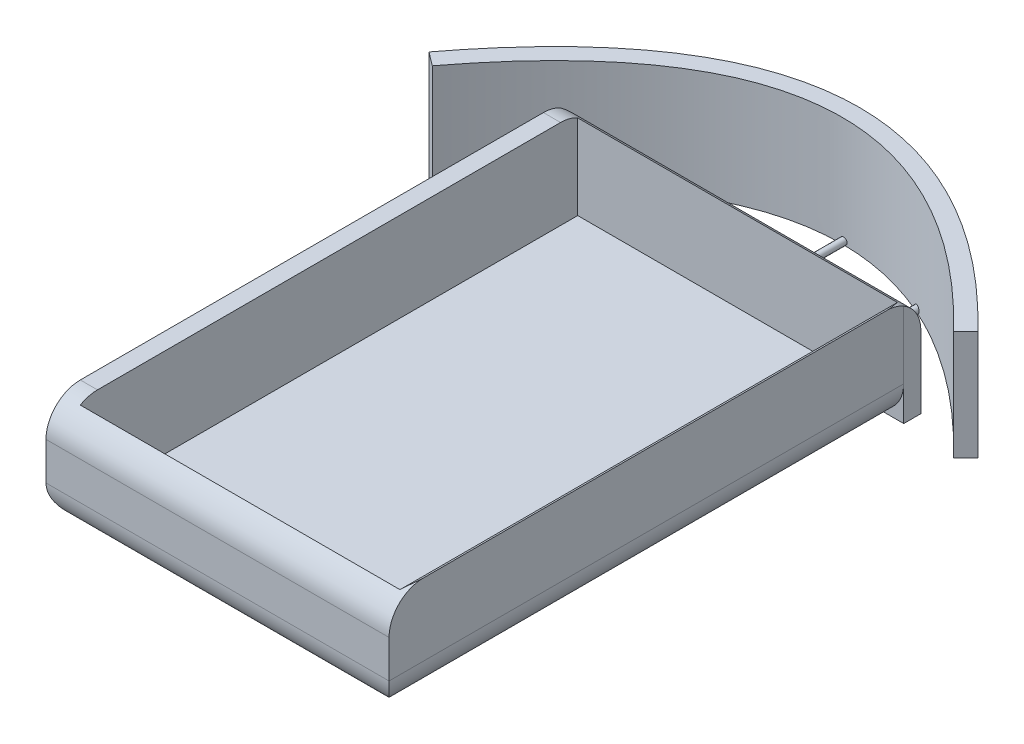
from build123d import *

# Parameters (mm, degrees)
BOSS_EXTRUDE1_DEPTH = 31
SKETCH5_W           = 90
SKETCH5_H           = 144.999999519
CUT_EXTRUDE2_DEPTH  = 26
SKETCH10_R          = 1.05
SKETCH10_R_2        = 1
BOSS_EXTRUDE3_DEPTH = 21
EXTRUDE_THIN2_START = -32
EXTRUDE_THIN2_DEPTH = 32
FILLET2_R           = 10
FILLET4_R           = 10
FILLET5_R           = 10
FILLET6_R           = 10
SKETCH15_R          = 1
BOSS_EXTRUDE4_DEPTH = 28


# Read off the part's stored shape, not the designer's step: Extrude-Thin2
with BuildPart() as part:
    # Sketch4 → Boss-Extrude1 (new body)
    with BuildSketch(Plane(origin=(0, 0, 0), x_dir=(1, 0, 0), z_dir=(0, 1, 0))):
        Polygon((-24.543123589, 51.393890829), (-24.485724986, 51.393890829), (-24.485724986, -98.606109173), (75.514275014, -98.606109173), (75.514275014, 51.393890827), (75.547211032, 51.393890827), (75.547211032, 56.393890829), (-24.543123589, 56.393890829), align=None)
    extrude(amount=BOSS_EXTRUDE1_DEPTH)

    # Sketch5 → Cut-Extrude2 (cut)
    with BuildSketch(Plane(origin=(0, 31, 0), x_dir=(1, 0, 0), z_dir=(0, 1, 0))):
        with Locations((25.514275014, -21.106109414)):
            Rectangle(SKETCH5_W, SKETCH5_H)
    extrude(amount=-CUT_EXTRUDE2_DEPTH, mode=Mode.SUBTRACT)

    # Sketch10 → Boss-Extrude3 (add)
    with BuildSketch(Plane(origin=(0, 0, -56.393890829), x_dir=(-1, 0, 0), z_dir=(0, 0, -1))):
        with Locations(Location((-55.547211032, 7, 0), (0, 0, 180))):
            Circle(SKETCH10_R)
        with Locations(Location((4.543123589, 7, 0), (0, 0, 180))):
            Circle(SKETCH10_R_2)
    extrude(amount=BOSS_EXTRUDE3_DEPTH)

    # Fillet2
    # the kernel refuses this fillet: 10 mm, written as the material it takes off along each edge
    with BuildSketch(Plane(origin=(-49.485724986, 31, 98.606109173), x_dir=(0, 0, -1), z_dir=(1, 0, 0))) as fillet2_piece_1:
        with BuildLine():
            CenterArc((FILLET2_R, -FILLET2_R), FILLET2_R, 90, 90)
            Line((0, -FILLET2_R), (0, 0))
            Line((0, 0), (FILLET2_R, 0))
        make_face()
    extrude(amount=150, mode=Mode.SUBTRACT)
    with BuildSketch(Plane(origin=(-24.485724986, 0, -51.393890829), x_dir=(0, 1, 0), z_dir=(0, 0, 1))) as fillet2_piece_2:
        with BuildLine():
            CenterArc((FILLET2_R, -FILLET2_R), FILLET2_R, 90, 90)
            Line((0, -FILLET2_R), (0, 0))
            Line((0, 0), (FILLET2_R, 0))
        make_face()
    extrude(amount=175.000000002, mode=Mode.SUBTRACT)
    with BuildSketch(Plane(origin=(-49.485724986, 0, 98.606109173), x_dir=(0, 0, -1), z_dir=(1, 0, 0))) as fillet2_piece_3:
        with BuildLine():
            CenterArc((FILLET2_R, FILLET2_R), FILLET2_R, 180, 90)
            Line((0, FILLET2_R), (0, 0))
            Line((0, 0), (FILLET2_R, 0))
        make_face()
    extrude(amount=150, mode=Mode.SUBTRACT)
    with BuildSketch(Plane(origin=(75.514275014, 0, 123.606109173), x_dir=(-1, 0, 0), z_dir=(0, 0, -1))) as fillet2_piece_4:
        with BuildLine():
            CenterArc((FILLET2_R, FILLET2_R), FILLET2_R, 180, 90)
            Line((0, FILLET2_R), (0, 0))
            Line((0, 0), (FILLET2_R, 0))
        make_face()
    extrude(amount=175, mode=Mode.SUBTRACT)

    # Fillet4
    # the kernel refuses this fillet: 10 mm, written as the material it takes off along each edge
    with BuildSketch(Plane(origin=(70.514275014, 31, -73.044525441), x_dir=(0, -1, 0), z_dir=(0, 0, 1))) as fillet4_piece_1_section:
        with BuildLine():
            CenterArc((8.660254038, 10), FILLET4_R, 210, 60)
            Line((0, 5), (0, 0))
            Line((0, 0), (8.660254038, 0))
        make_face()
    fillet4_piece_1 = extrude(amount=183.301269709, mode=Mode.PRIVATE)
    fillet4_piece_1 = split(fillet4_piece_1, bisect_by=Plane(origin=(71.836700468, 27.349745962, -51.393890827), z_dir=(0, 0, 1)), keep=Keep.TOP, mode=Mode.PRIVATE)
    fillet4_piece_1 = split(fillet4_piece_1, bisect_by=Plane(origin=(71.836700468, 27.349745962, 93.606109173), z_dir=(0, 0, -1)), keep=Keep.TOP, mode=Mode.PRIVATE)
    add(fillet4_piece_1, mode=Mode.SUBTRACT)

    # Fillet5
    # the kernel refuses this fillet: 10 mm, written as the material it takes off along each edge
    with BuildSketch(Plane(origin=(100.547211032, 31, -56.393890829), x_dir=(0, -1, 0), z_dir=(-1, 0, 0))) as fillet5_piece_1:
        with BuildLine():
            CenterArc((FILLET5_R, FILLET5_R), FILLET5_R, 180, 90)
            Line((0, FILLET5_R), (0, 0))
            Line((0, 0), (FILLET5_R, 0))
        make_face()
    extrude(amount=150.090334621, mode=Mode.SUBTRACT)

    # Fillet6
    # the kernel refuses this fillet: 10 mm, written as the material it takes off along each edge
    with BuildSketch(Plane(origin=(-24.543123589, -21.650635095, -56.393890829), x_dir=(0, 0, 1), z_dir=(0, 1, 0))) as fillet6_piece_1:
        with BuildLine():
            CenterArc((10, 8.660254038), FILLET6_R, 180, 60)
            Line((0, 8.660254038), (-0.2, 8.660254038))
            Line((-0.2, 8.660254038), (-0.2, 0))
            Line((-0.2, 0), (0, -0.2))
            ThreePointArc((0, -0.2), (2.5, -0.2), (4.9, -0.173205081))
            Line((4.9, -0.173205081), (5, 0))
        make_face()
    extrude(amount=64.301270189, mode=Mode.SUBTRACT)



with BuildPart() as body_2:
    # Extrude-Thin2 outline → Extrude-Thin2 (new body)
    with BuildSketch(Plane(origin=(0, 6.00667288, 0), x_dir=(-1, 0, 0), z_dir=(0, -1, 0)).offset(EXTRUDE_THIN2_START)):
        with BuildLine():
            Line((-101.106259616, 47.455416484), (-97.517183312, 43.974248393))
            add(Edge.make_bspline(
                [(-97.517183312, 43.974248393), (-90.947109033, 50.747979881), (-84.461523265, 56.594117718), (-71.690746068, 66.443323609), (-65.406461275, 70.445777381), (-53.067617331, 76.648178617), (-47.015104027, 78.848903051), (-35.121450693, 81.523458331), (-29.279693001, 82.000658953), (-17.700514878, 81.275147368), (-11.958520381, 80.072104414), (-0.470729692, 75.931508258), (5.275181576, 72.990557795), (16.783088845, 65.291546287), (22.542970532, 60.533005936), (34.041987864, 49.160363108), (39.780319498, 42.546980543), (45.491234369, 35.002570947)],
                knots=[0, 0, 0, 0, 0.125, 0.125, 0.25, 0.25, 0.375, 0.375, 0.5, 0.5, 0.625, 0.625, 0.75, 0.75, 0.875, 0.875, 1, 1, 1, 1], degree=3))
            Line((45.491234369, 35.002570947), (49.477851308, 38.020332599))
            add(Edge.make_bspline(
                [(-101.106259616, 47.455416484), (-20.540664315, 130.518360158), (49.477851308, 38.020332599)],
                knots=[0, 0, 0, 1, 1, 1], degree=2))
        make_face()
    extrude(amount=EXTRUDE_THIN2_DEPTH)


with BuildPart() as part_1:
    add(part.part)

    add(body_2.part)  # Boss-Extrude4 merges body 2
    # Sketch15 → Boss-Extrude4 (add)
    with BuildSketch(Plane(origin=(0, 0, -56.393890829), x_dir=(-1, 0, 0), z_dir=(0, 0, -1))):
        with Locations(Location((-27.678413699, 7, 0), (0, 0, 180))):
            Circle(SKETCH15_R)
    extrude(amount=BOSS_EXTRUDE4_DEPTH)


solid = part_1.part
